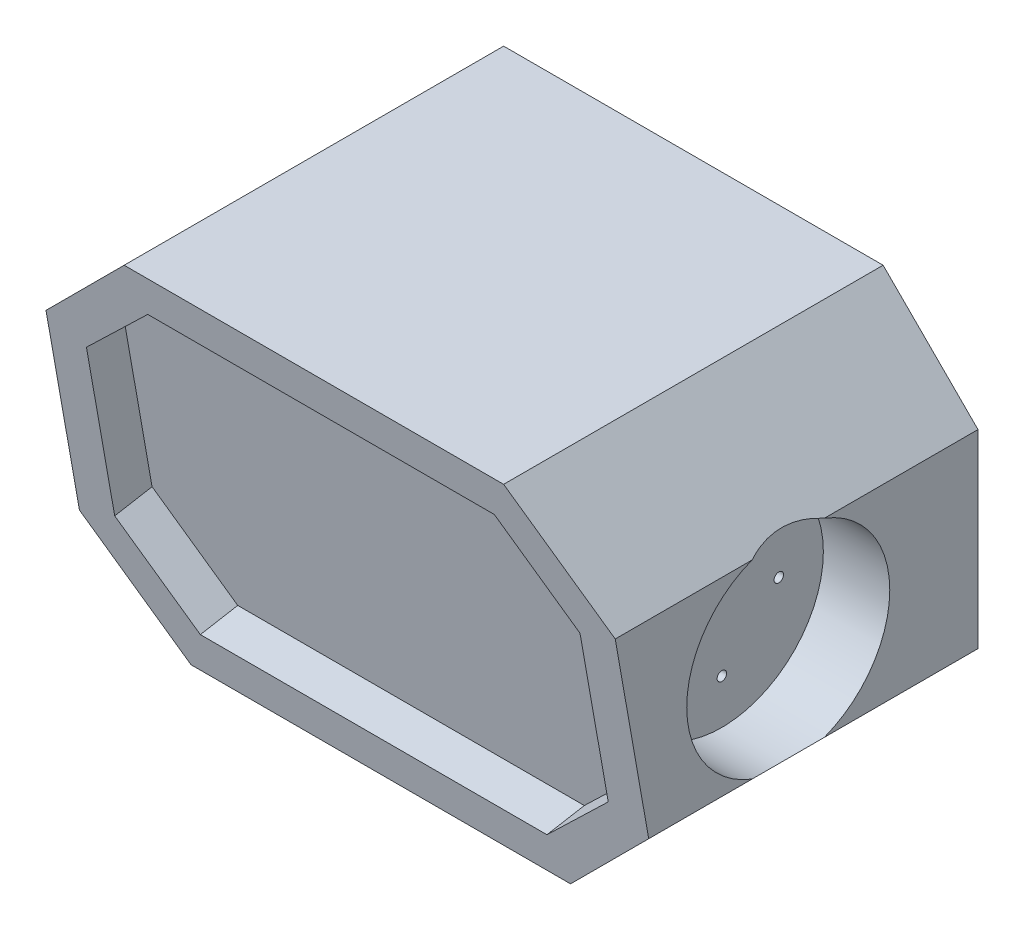
from build123d import *

# Parameters (mm, degrees)
SKETCH1_W           = 200
SKETCH1_H           = 200
BOSS_EXTRUDE1_DEPTH = 150
SKETCH2_R           = 53.5
CUT_EXTRUDE1_DEPTH  = 35
CUT_EXTRUDE3_DEPTH  = 332.662479036
CHAMFER2_SIZE       = 50
CUT_EXTRUDE5_DEPTH  = 20
CUT_EXTRUDE6_DEPTH  = 20
BOSS_EXTRUDE3_DEPTH = 9.2
SKETCH11_R          = 53.5
CUT_EXTRUDE7_DEPTH  = 35
SKETCH12_R          = 2.5
CUT_EXTRUDE8_DEPTH  = 10
SKETCH13_R          = 2.5
CUT_EXTRUDE9_DEPTH  = 10
CUT_EXTRUDE10_DEPTH = 105
SKETCH15_W          = 180
SKETCH15_H          = 80
CUT_EXTRUDE11_DEPTH = 10
SKETCH17_W          = 5
SKETCH17_H          = 80
CUT_EXTRUDE12_DEPTH = 5
SKETCH17_3_R        = 1.5
CUT_EXTRUDE13_DEPTH = 10


with BuildPart() as part:
    # Sketch1 → Boss-Extrude1 (new body)
    with BuildSketch(Plane(origin=(0, 0, 0), x_dir=(0, 0, -1), z_dir=(1, 0, 0))):
        Rectangle(SKETCH1_W, SKETCH1_H)
    extrude(amount=-BOSS_EXTRUDE1_DEPTH)

    # Sketch2 → Cut-Extrude1 (cut)
    with BuildSketch(Plane(origin=(0, 0, 0), x_dir=(0, 0, -1), z_dir=(1, 0, 0))):
        Circle(SKETCH2_R)
    extrude(amount=-CUT_EXTRUDE1_DEPTH, mode=Mode.SUBTRACT)

    # Mirror1: part across plane


with BuildPart() as part_1:
    add(part.part)
    add(part.part.mirror(Plane(origin=(-150, 0, 0), x_dir=(0, 0, 1), z_dir=(1, 0, 0))))

    # Sketch6 → Cut-Extrude3 (cut, through all)
    with BuildSketch(Plane(origin=(0, 0, 0), x_dir=(0, 0, -1), z_dir=(1, 0, 0))):
        Polygon((-100, 100), (-64.734603858, -100), (-100, -100), align=None)
    extrude(amount=-CUT_EXTRUDE3_DEPTH, mode=Mode.SUBTRACT)

    # Chamfer2
    # the kernel refuses this chamfer: 50 mm, written as the material it takes off along each edge
    with BuildSketch(Plane(origin=(-300, 100, -228.584149398), x_dir=(-0.027495876610586594, -0.9996219169112966, 0), z_dir=(0, 0, 1))) as chamfer2_piece_1:
        Polygon((CHAMFER2_SIZE * 0.999621916911, CHAMFER2_SIZE * 0.0274958766106), (-CHAMFER2_SIZE * 0.0274958766106, CHAMFER2_SIZE * 0.999621916911), (0, 0), align=None)
    extrude(amount=457.168298797, mode=Mode.SUBTRACT)
    with BuildSketch(Plane(origin=(-300, -100, 193.318753257), x_dir=(0.9996219169112966, -0.02749587661058631, 0), z_dir=(0, 0, -1))) as chamfer2_piece_2:
        Polygon((CHAMFER2_SIZE * 0.999621916911, -CHAMFER2_SIZE * 0.0274958766106), (-CHAMFER2_SIZE * 0.0274958766106, -CHAMFER2_SIZE * 0.999621916911), (0, 0), align=None)
    extrude(amount=421.902902655, mode=Mode.SUBTRACT)
    with BuildSketch(Plane(origin=(0, -100, 193.318753257), x_dir=(-0.9996219169112966, -0.027495876610586317, 0), z_dir=(0, 0, -1))) as chamfer2_piece_3:
        Polygon((CHAMFER2_SIZE * 0.999621916911, CHAMFER2_SIZE * 0.0274958766106), (-CHAMFER2_SIZE * 0.0274958766106, CHAMFER2_SIZE * 0.999621916911), (0, 0), align=None)
    extrude(amount=421.902902655, mode=Mode.SUBTRACT)
    with BuildSketch(Plane(origin=(0, 100, -228.584149398), x_dir=(0.02749587661058637, -0.9996219169112966, 0), z_dir=(0, 0, 1))) as chamfer2_piece_4:
        Polygon((CHAMFER2_SIZE * 0.999621916911, -CHAMFER2_SIZE * 0.0274958766106), (-CHAMFER2_SIZE * 0.0274958766106, -CHAMFER2_SIZE * 0.999621916911), (0, 0), align=None)
    extrude(amount=457.168298797, mode=Mode.SUBTRACT)

    # Sketch8 → Cut-Extrude5 (cut)
    with BuildSketch(Plane(origin=(0, -14.085638206, 79.883623873), x_dir=(1, 0, 0), z_dir=(0, -0.17364817766693483, 0.9848077530122074))):
        Polygon((-280, -28.273659533), (-241.625912379, -67.239729309), (-58.966069777, -67.239729309), (-20, -28.865641689), (-20, 56.879523291), (-58.374087621, 95.845593068), (-241.033930223, 95.845593068), (-280, 57.471505447), align=None)
    extrude(amount=-CUT_EXTRUDE5_DEPTH, mode=Mode.SUBTRACT)

    # Sketch9 → Cut-Extrude6 (cut)
    with BuildSketch(Plane(origin=(0, 0, -100), x_dir=(-1, 0, 0), z_dir=(0, 0, -1))):
        with BuildLine():
            ThreePointArc((249.615655403, -75.509742408), (275, 0), (249.615655403, 75.509742408))
            ThreePointArc((249.615655403, 75.509742408), (228.600607666, 78.402451968), (225.707898107, 57.38740423))
            ThreePointArc((225.707898107, 57.38740423), (245, 0), (225.707898107, -57.38740423))
            ThreePointArc((225.707898107, -57.38740423), (228.600607666, -78.402451968), (249.615655403, -75.509742408))
        make_face()
        with BuildLine():
            ThreePointArc((50.384344597, 75.509742408), (71.399392334, 78.402451968), (74.292101893, 57.38740423))
            ThreePointArc((74.292101893, 57.38740423), (55, 0), (74.292101893, -57.38740423))
            ThreePointArc((74.292101893, -57.38740423), (71.399392334, -78.402451968), (50.384344597, -75.509742408))
            ThreePointArc((50.384344597, -75.509742408), (25, 0), (50.384344597, 75.509742408))
        make_face()
    extrude(amount=-CUT_EXTRUDE6_DEPTH, mode=Mode.SUBTRACT)

    # Sketch10 → Boss-Extrude3 (add)
    # profile 1 of 2: a face of its own
    with BuildSketch(Plane(origin=(0, 0, -100), x_dir=(-1, 0, 0), z_dir=(0, 0, -1))):
        with BuildLine():
            ThreePointArc((74.292101893, 57.38740423), (55, 0), (74.292101893, -57.38740423))
            ThreePointArc((74.292101893, -57.38740423), (71.399392334, -78.402451968), (50.384344597, -75.509742408))
            ThreePointArc((50.384344597, -75.509742408), (25, 0), (50.384344597, 75.509742408))
            ThreePointArc((50.384344597, 75.509742408), (71.399392334, 78.402451968), (74.292101893, 57.38740423))
        make_face()
        with BuildLine():
            ThreePointArc((70.307475677, 60.407793927), (50, 0), (70.307475677, -60.407793927))
            ThreePointArc((70.307475677, -60.407793927), (68.379002638, -74.417825752), (54.368970813, -72.489352712))
            ThreePointArc((54.368970813, -72.489352712), (30, 0), (54.368970813, 72.489352712))
            ThreePointArc((54.368970813, 72.489352712), (68.379002638, 74.417825752), (70.307475677, 60.407793927))
        make_face(mode=Mode.SUBTRACT)
    # profile 2 of 2: a face of its own
    with BuildSketch(Plane(origin=(0, 0, -100), x_dir=(-1, 0, 0), z_dir=(0, 0, -1))):
        with BuildLine():
            ThreePointArc((249.615655403, 75.509742408), (228.600607666, 78.402451968), (225.707898107, 57.38740423))
            ThreePointArc((225.707898107, 57.38740423), (245, 0), (225.707898107, -57.38740423))
            ThreePointArc((225.707898107, -57.38740423), (228.600607666, -78.402451968), (249.615655403, -75.509742408))
            ThreePointArc((249.615655403, -75.509742408), (275, 0), (249.615655403, 75.509742408))
        make_face()
        with BuildLine():
            ThreePointArc((245.631029187, 72.489352712), (231.620997362, 74.417825752), (229.692524323, 60.407793927))
            ThreePointArc((229.692524323, 60.407793927), (250, 0), (229.692524323, -60.407793927))
            ThreePointArc((229.692524323, -60.407793927), (231.620997362, -74.417825752), (245.631029187, -72.489352712))
            ThreePointArc((245.631029187, -72.489352712), (270, 0), (245.631029187, 72.489352712))
        make_face(mode=Mode.SUBTRACT)
    extrude(amount=-BOSS_EXTRUDE3_DEPTH)

    # Sketch11 → Cut-Extrude7 (cut)
    with BuildSketch(Plane(origin=(0, 0, -100), x_dir=(-1, 0, 0), z_dir=(0, 0, -1))):
        with Locations((150, 0)):
            Circle(SKETCH11_R)
    extrude(amount=-CUT_EXTRUDE7_DEPTH, mode=Mode.SUBTRACT)

    # Sketch12 → Cut-Extrude8 (cut)
    with BuildSketch(Plane(origin=(-35, 0, 0), x_dir=(0, 0, -1), z_dir=(1, 0, 0))):
        with Locations((0, 30)):
            Circle(SKETCH12_R)
        with Locations((30, 0)):
            Circle(SKETCH12_R)
        with Locations((0, -30)):
            Circle(SKETCH12_R)
        with Locations((-30, 0)):
            Circle(SKETCH12_R)
    cut_extrude8 = extrude(amount=-CUT_EXTRUDE8_DEPTH, mode=Mode.SUBTRACT)

    # Mirror2: Cut-Extrude8 across plane
    add(cut_extrude8.mirror(Plane(origin=(-150, 0, 0), x_dir=(0, 0, 1), z_dir=(1, 0, 0))), mode=Mode.SUBTRACT)

    # Sketch13 → Cut-Extrude9 (cut)
    with BuildSketch(Plane(origin=(0, 0, -65), x_dir=(-1, 0, 0), z_dir=(0, 0, -1))):
        with Locations((150, 25)):
            Circle(SKETCH13_R)
        with Locations((150, -25)):
            Circle(SKETCH13_R)
        with Locations((175, 0)):
            Circle(SKETCH13_R)
        with Locations((125, 0)):
            Circle(SKETCH13_R)
    extrude(amount=-CUT_EXTRUDE9_DEPTH, mode=Mode.SUBTRACT)

    # Sketch14 → Cut-Extrude10 (cut, symmetric)
    with BuildSketch(Plane(origin=(-150, 0, 0), x_dir=(0, 0, -1), z_dir=(1, 0, 0))):
        Polygon((-67.773931836, 90), (-36.035075309, -90), (55, -90), (55, 90), align=None)
    extrude(amount=CUT_EXTRUDE10_DEPTH, both=True, mode=Mode.SUBTRACT)

    # Sketch15 → Cut-Extrude11 (cut)
    with BuildSketch(Plane.XZ.offset(100)):
        with Locations((-150, -15)):
            Rectangle(SKETCH15_W, SKETCH15_H)
    extrude(amount=-CUT_EXTRUDE11_DEPTH, mode=Mode.SUBTRACT)

    # Sketch17 → Cut-Extrude12 (cut)
    with BuildSketch(Plane.XZ.offset(100)):
        with Locations((-242.5, -15)):
            Rectangle(SKETCH17_W, SKETCH17_H)
        with Locations((-57.5, -15)):
            Rectangle(SKETCH17_W, SKETCH17_H)
    extrude(amount=-CUT_EXTRUDE12_DEPTH, mode=Mode.SUBTRACT)

    # Sketch17<3> → Cut-Extrude13 (cut)
    with BuildSketch(Plane.XZ.offset(100)):
        with Locations(Location((-57.5, -10, 0), (0, 0, 270))):
            Circle(SKETCH17_3_R)
        with Locations(Location((-242.5, 20, 0), (0, 0, 270))):
            Circle(SKETCH17_3_R)
        with Locations(Location((-242.5, 10, 0), (0, 0, 270))):
            Circle(SKETCH17_3_R)
        with Locations(Location((-242.5, 0, 0), (0, 0, 270))):
            Circle(SKETCH17_3_R)
        with Locations(Location((-242.5, -10, 0), (0, 0, 270))):
            Circle(SKETCH17_3_R)
        with Locations(Location((-242.5, -20, 0), (0, 0, 270))):
            Circle(SKETCH17_3_R)
        with Locations(Location((-242.5, -30, 0), (0, 0, 270))):
            Circle(SKETCH17_3_R)
        with Locations(Location((-242.5, -40, 0), (0, 0, 270))):
            Circle(SKETCH17_3_R)
        with Locations(Location((-242.5, -50, 0), (0, 0, 270))):
            Circle(SKETCH17_3_R)
        with Locations(Location((-57.5, -50, 0), (0, 0, 270))):
            Circle(SKETCH17_3_R)
        with Locations(Location((-57.5, -40, 0), (0, 0, 270))):
            Circle(SKETCH17_3_R)
        with Locations(Location((-57.5, -30, 0), (0, 0, 270))):
            Circle(SKETCH17_3_R)
        with Locations(Location((-57.5, -20, 0), (0, 0, 270))):
            Circle(SKETCH17_3_R)
        with Locations(Location((-57.5, 0, 0), (0, 0, 270))):
            Circle(SKETCH17_3_R)
        with Locations(Location((-57.5, 10, 0), (0, 0, 270))):
            Circle(SKETCH17_3_R)
        with Locations(Location((-57.5, 20, 0), (0, 0, 270))):
            Circle(SKETCH17_3_R)
    extrude(amount=-CUT_EXTRUDE13_DEPTH, mode=Mode.SUBTRACT)


solid = part_1.part
